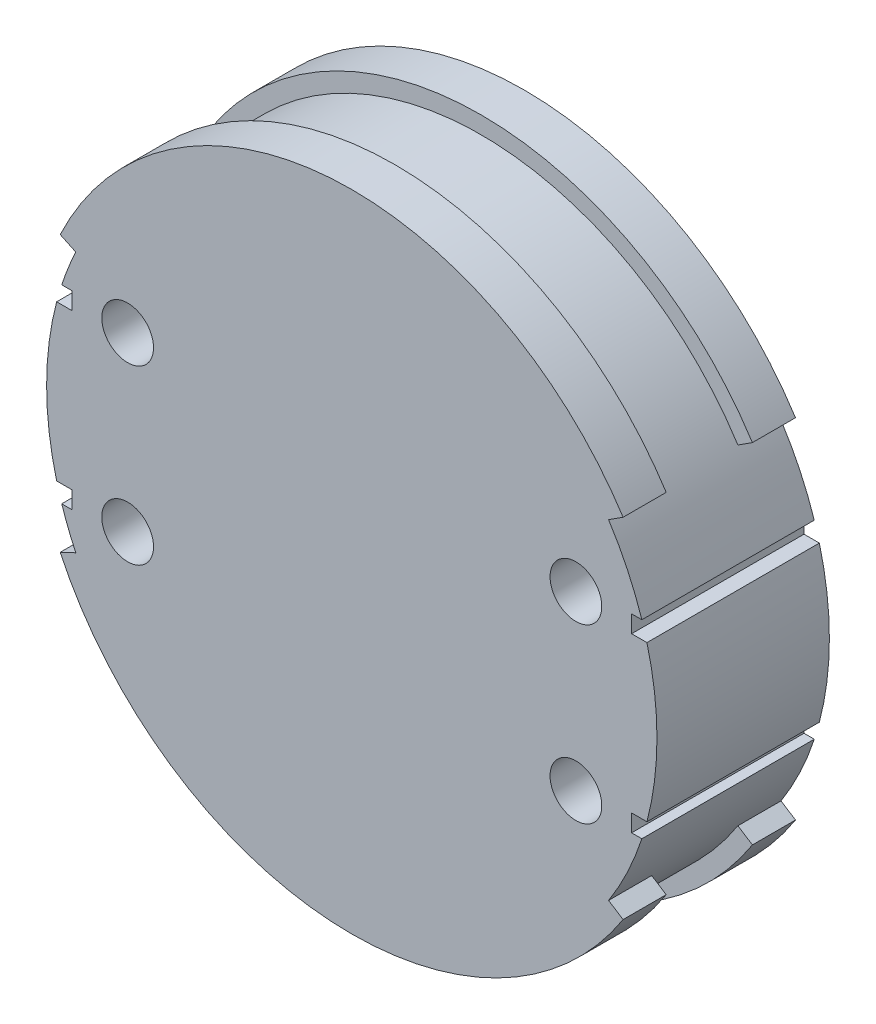
from build123d import *

# Parameters (mm, degrees)
CROQUIS1_R                   = 17.7
SALIENTE_EXTRUIR1_DEPTH      = 10
ENVOLVER1_SECTION_W          = 1
ENVOLVER1_SECTION_H          = 2.5
ENVOLVER1_ANGLE              = 122.036773313
ENVOLVER1_SECTOR_2_SECTION_W = 1
ENVOLVER1_SECTOR_2_SECTION_H = 2.5
ENVOLVER1_SECTOR_2_ANGLE     = 122.036773313
SIMETR_A1_DEPTH              = 2.5
SIMETR_A1_START              = 7.5
SIMETR_A1_2_DEPTH            = 2.5
CAVIDAD1_DEPTH               = 4.2
SALIENTE_EXTRUIR2_START      = 4.2
SALIENTE_EXTRUIR2_DEPTH      = 4.2
CROQUIS6_R                   = 1.5
CORTAR_EXTRUIR1_DEPTH        = 10
CROQUIS8_W                   = 1.5
CROQUIS8_H                   = 1
CORTAR_EXTRUIR2_DEPTH        = 10
SIMETR_A4_COPY_1_SKETCH_R    = 1.5
SIMETR_A4_COPY_1_DEPTH       = 10
SIMETR_A4_COPY_2_SKETCH_W    = 1.5
SIMETR_A4_COPY_2_SKETCH_H    = 1
SIMETR_A4_COPY_2_DEPTH       = 10


# Read off the part's stored shape, not the designer's step: Simetría1, Cavidad1
with BuildPart() as part:
    # Croquis1 → Saliente-Extruir1 (new body)
    with BuildSketch(Plane.XY):
        Circle(CROQUIS1_R)
    extrude(amount=SALIENTE_EXTRUIR1_DEPTH)

    # Envolver1 section (on wrap section) → Envolver1 (revolve)
    with BuildSketch(Plane(origin=(0, 0, 0), x_dir=(-0.9043880828615337, 0.4267109039830592, 0), z_dir=(-0.4267109039830592, -0.9043880828615337, 0))):
        with Locations((18.2, -8.75)):
            Rectangle(ENVOLVER1_SECTION_W, ENVOLVER1_SECTION_H)
    revolve(axis=Axis((0, 0, 0), (0, 0, -1)), revolution_arc=ENVOLVER1_ANGLE)

    # Envolver1 sector 2 section (on wrap section) → Envolver1 sector 2 (revolve)
    with BuildSketch(Plane(origin=(0, 0, 0), x_dir=(-0.9043880828615337, 0.4267109039830592, 0), z_dir=(-0.4267109039830592, -0.9043880828615337, 0))):
        with Locations((18.2, -1.25)):
            Rectangle(ENVOLVER1_SECTOR_2_SECTION_W, ENVOLVER1_SECTOR_2_SECTION_H)
    revolve(axis=Axis((0, 0, 0), (0, 0, -1)), revolution_arc=ENVOLVER1_SECTOR_2_ANGLE)

    # Simetría1 outline → Simetría1 (add)
    with BuildSketch(Plane.XY):
        with BuildLine():
            ThreePointArc((-16.91205715, -7.979493904), (-1.214117133, -18.660544461), (15.735507416, -10.10365312))
            Line((15.735507416, -10.10365312), (14.894036431, -9.563350814))
            ThreePointArc((14.894036431, -9.563350814), (-1.149191083, -17.662654383), (-16.007669067, -7.552783))
            Line((-16.007669067, -7.552783), (-16.91205715, -7.979493904))
        make_face()
    extrude(amount=SIMETR_A1_DEPTH)

    # Simetr_a1 2 outline → Simetr_a1 2 (add)
    with BuildSketch(Plane.XY.offset(SIMETR_A1_START)):
        with BuildLine():
            ThreePointArc((-16.91205715, -7.979493904), (-1.214117133, -18.660544461), (15.735507416, -10.10365312))
            Line((15.735507416, -10.10365312), (14.894036431, -9.563350814))
            ThreePointArc((14.894036431, -9.563350814), (-1.149191083, -17.662654383), (-16.007669067, -7.552783))
            Line((-16.007669067, -7.552783), (-16.91205715, -7.979493904))
        make_face()
    extrude(amount=SIMETR_A1_2_DEPTH)

    # Cavidad1 outline → Cavidad1 (cut)
    with BuildSketch(Plane.XY):
        with BuildLine():
            Line((15.575034164, 2.196722968), (2.429979424, 2.915))
            ThreePointArc((2.429979424, 2.915), (0, 3.795), (-2.429979424, 2.915))
            Line((-2.429979424, 2.915), (-15.575034164, 2.196722968))
            ThreePointArc((-15.575034164, 2.196722968), (-17.655, 0), (-15.575034164, -2.196722968))
            Line((-15.575034164, -2.196722968), (-2.429979424, -2.915))
            ThreePointArc((-2.429979424, -2.915), (0, -3.795), (2.429979424, -2.915))
            Line((2.429979424, -2.915), (15.575034164, -2.196722968))
            ThreePointArc((15.575034164, -2.196722968), (17.655, 0), (15.575034164, 2.196722968))
        make_face()
    extrude(amount=CAVIDAD1_DEPTH, mode=Mode.SUBTRACT)

    # Croquis5 → Saliente-Extruir2 (add)
    with BuildSketch(Plane(origin=(0, 0, 4.2), x_dir=(-1, 0, 0), z_dir=(0, 0, -1)).offset(SALIENTE_EXTRUIR2_START)):
        with BuildLine():
            Line((16.6, -1.878556627), (16.6, 1.878556627))
            ThreePointArc((16.6, 1.878556627), (17.655, 0), (16.6, -1.878556627))
        make_face()
    saliente_extruir2 = extrude(amount=-SALIENTE_EXTRUIR2_DEPTH)

    # Simetría2: Saliente-Extruir2 across plane
    add(saliente_extruir2.mirror(Plane(origin=(0, 0, 0), x_dir=(0, 0, 1), z_dir=(1, 0, 0))))

    # Croquis6 → Cortar-Extruir1 (cut)
    with BuildSketch(Plane(origin=(0, 0, 0), x_dir=(-1, 0, 0), z_dir=(0, 0, -1))):
        with Locations((-13, 5)):
            Circle(CROQUIS6_R)
    cortar_extruir1 = extrude(amount=-CORTAR_EXTRUIR1_DEPTH, mode=Mode.SUBTRACT)

    # Croquis8 → Cortar-Extruir2 (cut)
    with BuildSketch(Plane(origin=(0, 0, 0), x_dir=(-1, 0, 0), z_dir=(0, 0, -1))):
        with Locations((-16.979104806, 5)):
            Rectangle(CROQUIS8_W, CROQUIS8_H)
    cortar_extruir2 = extrude(amount=-CORTAR_EXTRUIR2_DEPTH, mode=Mode.SUBTRACT)

    # Simetría3: Cortar-Extruir1, Cortar-Extruir2 across plane
    add(cortar_extruir1.mirror(Plane.ZX), mode=Mode.SUBTRACT)
    add(cortar_extruir2.mirror(Plane.ZX), mode=Mode.SUBTRACT)

    # Simetría4: Cortar-Extruir1, Cortar-Extruir2 across plane
    add(cortar_extruir1.mirror(Plane(origin=(0, 0, 0), x_dir=(0, 0, 1), z_dir=(1, 0, 0))), mode=Mode.SUBTRACT)
    add(cortar_extruir2.mirror(Plane(origin=(0, 0, 0), x_dir=(0, 0, 1), z_dir=(1, 0, 0))), mode=Mode.SUBTRACT)

    # Simetría4 copy 1 sketch → Simetría4 copy 1 (cut)
    with BuildSketch(Plane(origin=(0, 0, 0), x_dir=(1, 0, 0), z_dir=(0, 0, -1))):
        with Locations((-13, 5)):
            Circle(SIMETR_A4_COPY_1_SKETCH_R)
    extrude(amount=-SIMETR_A4_COPY_1_DEPTH, mode=Mode.SUBTRACT)

    # Simetría4 copy 2 sketch → Simetría4 copy 2 (cut)
    with BuildSketch(Plane(origin=(0, 0, 0), x_dir=(1, 0, 0), z_dir=(0, 0, -1))):
        with Locations((-16.979104806, 5)):
            Rectangle(SIMETR_A4_COPY_2_SKETCH_W, SIMETR_A4_COPY_2_SKETCH_H)
    extrude(amount=-SIMETR_A4_COPY_2_DEPTH, mode=Mode.SUBTRACT)


solid = part.part
